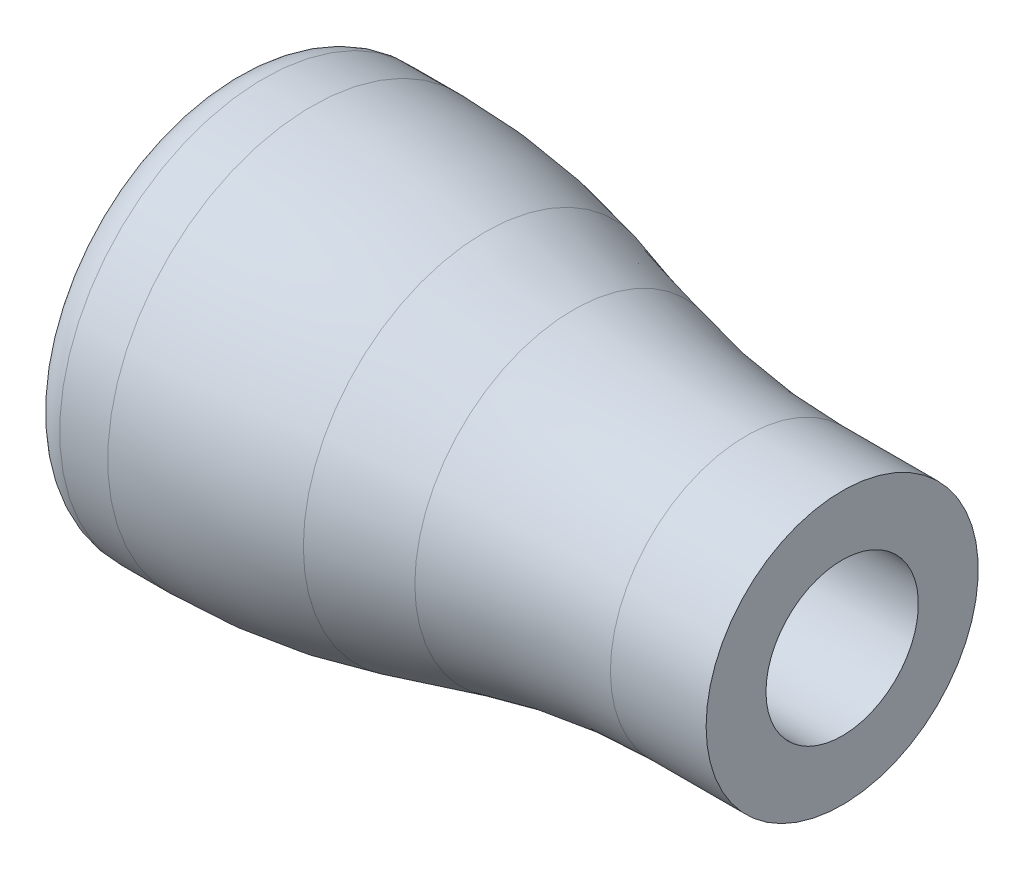
from build123d import *

# Parameters (mm, degrees)
FILLET2_R = 0.05
FILLET4_R = 0.02
FILLET5_R = 10
FILLET6_R = 10
FILLET7_R = 0.5


with BuildPart() as part:
    # Sketch2 → Revolve1 (revolve)
    with BuildSketch(Plane.XY, mode=Mode.PRIVATE) as revolve1_sk:
        Polygon((-9, 0), (-9, 3), (-6.5, 3), (-2.7, 2), (0, 2), (0, 0), align=None)
    revolve(revolve1_sk.sketch.rotate(Axis((-11.002436832, 0, 0), (1, 0, 0)), 90), axis=Axis((-11.002436832, 0, 0), (1, 0, 0)))

    # Sketch1 → Cut-Revolve1 (revolve, cut)
    with BuildSketch(Plane.XY, mode=Mode.PRIVATE) as cut_revolve1_sk:
        Polygon((-9, 0), (-9, 2.03), (-8.95, 2.03), (-8.95, 2.08), (-6.9, 2.08), (-6.9, 0.326243131), (-2.3, 0.326243131), (-2.3, 1.12), (0, 1.12), (0, 0), align=None)
    revolve(cut_revolve1_sk.sketch.rotate(Axis((-11.002436832, 0, 0), (1, 0, 0)), 90), axis=Axis((-11.002436832, 0, 0), (1, 0, 0)), mode=Mode.SUBTRACT)

    # Fillet2
    fillet2_edges = [part.edges().sort_by_distance(p)[0] for p in [
        (-8.95, 0, -2.03),
    ]]
    fillet(fillet2_edges, radius=FILLET2_R - 0.0001)  # a hair under: the kernel refuses the full size

    # Fillet4
    fillet4_edges = [part.edges().sort_by_distance(p)[0] for p in [
        (-9, 0, -2.03),
    ]]
    fillet(fillet4_edges, radius=FILLET4_R)

    # Fillet5
    fillet5_edges = [part.edges().sort_by_distance(p)[0] for p in [
        (-6.5, 0, -3),
    ]]
    fillet(fillet5_edges, radius=FILLET5_R)

    # Fillet6
    fillet6_edges = [part.edges().sort_by_distance(p)[0] for p in [
        (-2.7, 0, -2),
    ]]
    fillet(fillet6_edges, radius=FILLET6_R)

    # Fillet7
    fillet7_edges = [part.edges().sort_by_distance(p)[0] for p in [
        (-9, 0, -3),
    ]]
    fillet(fillet7_edges, radius=FILLET7_R)


solid = part.part
